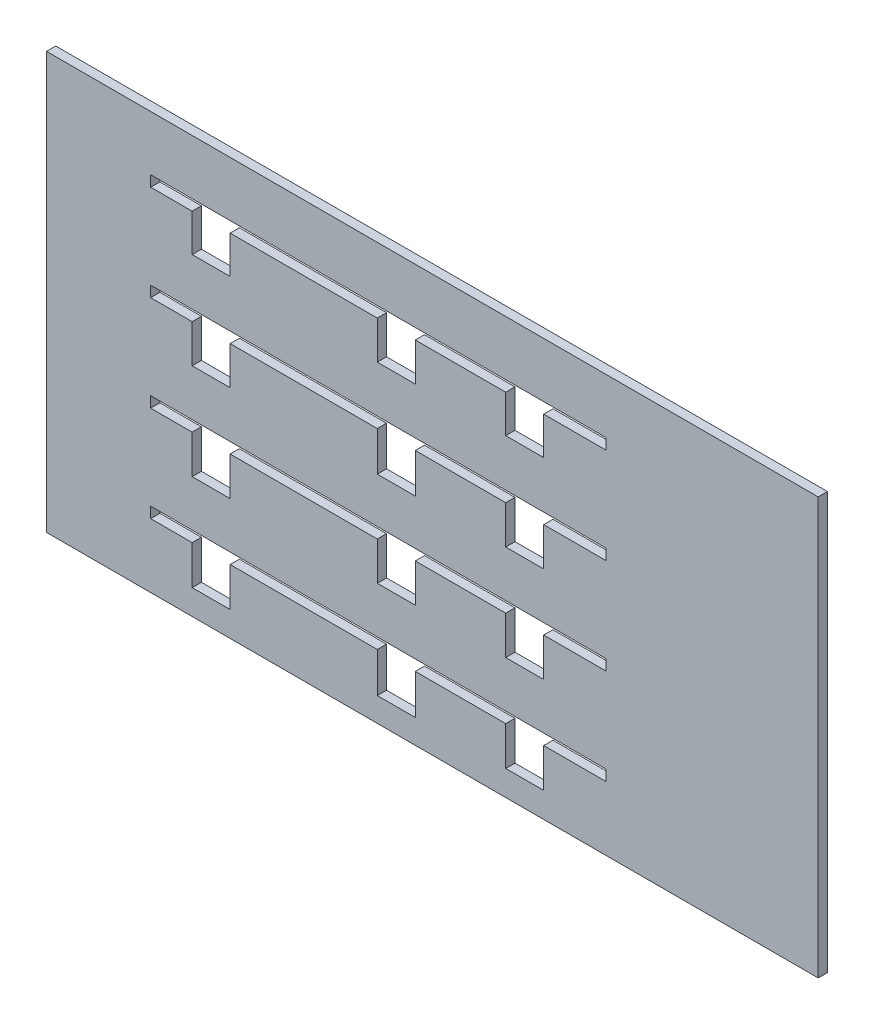
from build123d import *

# Parameters (mm, degrees)
BOSS_EXTRUDE1_DEPTH = 3
SKETCH3_W           = 147.5
SKETCH3_H           = 3.5
SKETCH3_W_2         = 147
SKETCH3_H_2         = 3
CUT_EXTRUDE2_DEPTH  = 3
SKETCH5_W           = 12.3
SKETCH5_H           = 12.242663802
SKETCH5_H_2         = 12.636864516
SKETCH5_H_3         = 12.287493002
SKETCH5_H_4         = 12.472357618
SKETCH5_H_5         = 13.304171608
SKETCH5_H_6         = 12.586431708
SKETCH5_H_7         = 12.696592172
SKETCH5_H_8         = 12.539429726
SKETCH5_H_9         = 12.626785208
SKETCH5_H_10        = 12.863793976
SKETCH5_H_11        = 13.571866278
SKETCH5_H_12        = 12.971934766
CUT_EXTRUDE8_DEPTH  = 10


with BuildPart() as part:
    # Sketch1 → Boss-Extrude1 (new body)
    with BuildSketch(Plane.XY):
        Polygon((79.894045329, 76.229765013), (148.894045329, 76.229765013), (148.894045329, -58.770234987), (79.894045329, -58.770234987), (-67.167101828, -58.770234987), (-72.167101828, -58.770234987), (-98.167101828, -58.770234987), (-101.167101828, -58.770234987), (-101.167101828, 76.229765013), (-98.167101828, 76.229765013), (-72.167101828, 76.229765013), (-67.167101828, 76.229765013), align=None)
    extrude(amount=-BOSS_EXTRUDE1_DEPTH)

    # Sketch3 → Cut-Extrude2 (cut)
    # profile 1 of 4: a face of its own
    with BuildSketch(Plane.XY):
        with Locations((6.332898172, 56.729765013)):
            Rectangle(SKETCH3_W, SKETCH3_H)
        with Locations((6.332898172, 56.729765013)):
            Rectangle(SKETCH3_W_2, SKETCH3_H_2, mode=Mode.SUBTRACT)
    # profile 2 of 4: a face of its own
    with BuildSketch(Plane.XY):
        with Locations((6.332898172, 25.729765013)):
            Rectangle(SKETCH3_W, SKETCH3_H)
        with Locations((6.332898172, 25.729765013)):
            Rectangle(SKETCH3_W_2, SKETCH3_H_2, mode=Mode.SUBTRACT)
    # profile 3 of 4: a face of its own
    with BuildSketch(Plane.XY):
        with Locations((6.332898172, -5.270234987)):
            Rectangle(SKETCH3_W, SKETCH3_H)
        with Locations((6.332898172, -5.270234987)):
            Rectangle(SKETCH3_W_2, SKETCH3_H_2, mode=Mode.SUBTRACT)
    # profile 4 of 4: a face of its own
    with BuildSketch(Plane.XY):
        with Locations((6.332898172, -36.270234987)):
            Rectangle(SKETCH3_W, SKETCH3_H)
        with Locations((6.332898172, -36.270234987)):
            Rectangle(SKETCH3_W_2, SKETCH3_H_2, mode=Mode.SUBTRACT)
    extrude(amount=-CUT_EXTRUDE2_DEPTH, mode=Mode.SUBTRACT)


with BuildPart() as body_2:
    # of the pieces the cut leaves, the one that is kept (cut_extrude2_keep)
    add(part.part.solids().sort_by_distance((148.894045329, 76.229765013, 0))[0])

    # Sketch5 → Cut-Extrude8 (cut)
    with BuildSketch(Plane.XY):
        with Locations((-47.817101828, 48.929765013)):
            Rectangle(SKETCH5_W, SKETCH5_H)
        with Locations((12.172898172, 48.929765013)):
            Rectangle(SKETCH5_W, SKETCH5_H_2)
        with Locations((53.782898172, 48.929765013)):
            Rectangle(SKETCH5_W, SKETCH5_H_3)
        with Locations((-47.817101828, 17.829765013)):
            Rectangle(SKETCH5_W, SKETCH5_H_4)
        with Locations((12.172898172, 17.829765013)):
            Rectangle(SKETCH5_W, SKETCH5_H_5)
        with Locations((53.782898172, 17.829765013)):
            Rectangle(SKETCH5_W, SKETCH5_H_6)
        with Locations((-47.817101828, -13.170234987)):
            Rectangle(SKETCH5_W, SKETCH5_H_7)
        with Locations((12.172898172, -13.170234987)):
            Rectangle(SKETCH5_W, SKETCH5_H_8)
        with Locations((53.782898172, -13.170234987)):
            Rectangle(SKETCH5_W, SKETCH5_H_9)
        with Locations((53.782898172, -44.170234987)):
            Rectangle(SKETCH5_W, SKETCH5_H_10)
        with Locations((12.172898172, -44.170234987)):
            Rectangle(SKETCH5_W, SKETCH5_H_11)
        with Locations((-47.817101828, -44.170234987)):
            Rectangle(SKETCH5_W, SKETCH5_H_12)
    extrude(amount=-CUT_EXTRUDE8_DEPTH, mode=Mode.SUBTRACT)


solid = body_2.part
